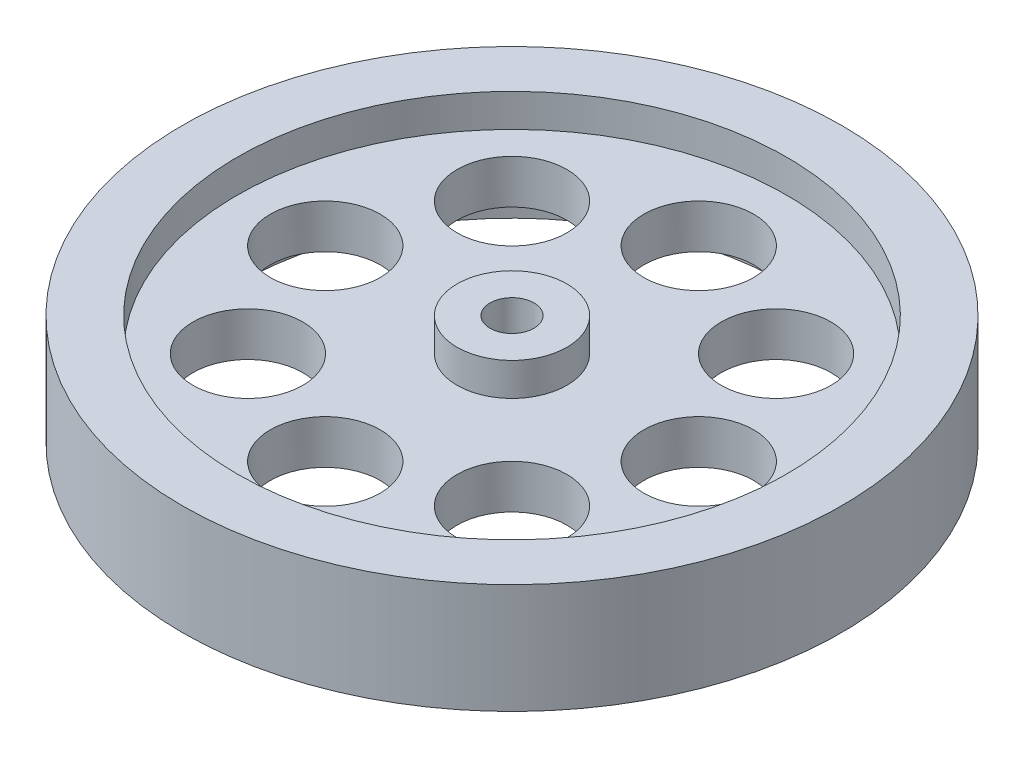
from build123d import *

# Parameters (mm, degrees)
SKETCH2_R          = 5
CUT_EXTRUDE2_DEPTH = 44


with BuildPart() as part:
    # Sketch1 → Revolve1 (revolve)
    with BuildSketch(Plane.XY):
        Polygon((-30, 10), (-30, 0), (-25, 0), (-25, 3), (-5, 3), (-5, 0), (-3, 0), (-1.5, 1.5), (-1.5, 4), (-2, 4), (-2, 10), (-5, 10), (-5, 7), (-25, 7), (-25, 10), align=None)
    revolve(axis=Axis((0, 0, 0), (0, -1, 0)))

    # Sketch2 → Cut-Extrude2 (cut, through all)
    with BuildSketch(Plane.XZ.offset(-3)):
        with Locations((-17, 0)):
            Circle(SKETCH2_R)
        with Locations((-12.02081528, 12.02081528)):
            Circle(SKETCH2_R)
        with Locations((0, 17)):
            Circle(SKETCH2_R)
        with Locations((12.02081528, 12.02081528)):
            Circle(SKETCH2_R)
        with Locations((17, 0)):
            Circle(SKETCH2_R)
        with Locations((12.02081528, -12.02081528)):
            Circle(SKETCH2_R)
        with Locations((0, -17)):
            Circle(SKETCH2_R)
        with Locations((-12.02081528, -12.02081528)):
            Circle(SKETCH2_R)
    extrude(amount=-CUT_EXTRUDE2_DEPTH, mode=Mode.SUBTRACT)


solid = part.part
